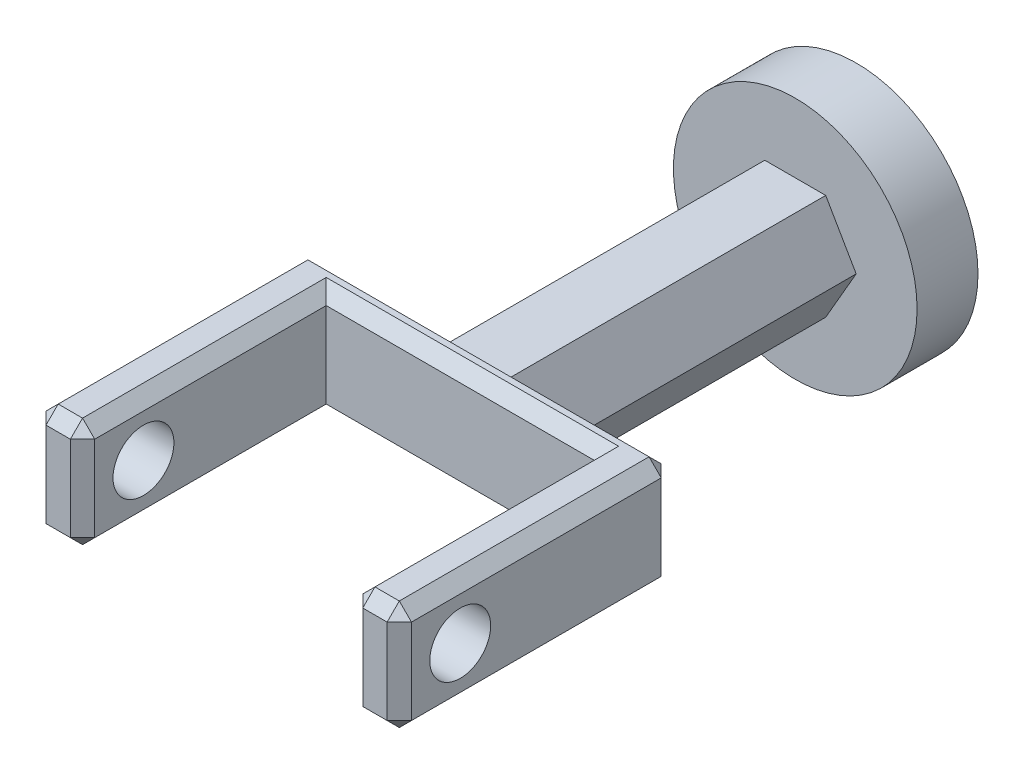
from build123d import *

# Parameters (mm, degrees)
CROQUIS1_R              = 200
SALIENTE_EXTRUIR1_DEPTH = 100
SALIENTE_EXTRUIR2_DEPTH = 500
CROQUIS3_W              = 600
CROQUIS3_H              = 180
SALIENTE_EXTRUIR3_DEPTH = 50
CROQUIS4_W              = 80
CROQUIS4_H              = 180
SALIENTE_EXTRUIR4_DEPTH = 400
CROQUIS5_R              = 50
CORTAR_EXTRUIR1_DEPTH   = 1226.765067213


with BuildPart() as part:
    # Croquis1 → Saliente-Extruir1 (new body)
    with BuildSketch(Plane.XY):
        Circle(CROQUIS1_R)
    extrude(amount=SALIENTE_EXTRUIR1_DEPTH)

    # Croquis2 → Saliente-Extruir2 (add)
    with BuildSketch(Plane.XY.offset(100)):
        Polygon((100, 0), (50, 86.602540378), (-50, 86.602540378), (-100, 0), (-50, -86.602540378), (50, -86.602540378), align=None)
    extrude(amount=SALIENTE_EXTRUIR2_DEPTH)

    # Croquis3 → Saliente-Extruir3 (add)
    with BuildSketch(Plane.XY.offset(600)):
        Rectangle(CROQUIS3_W, CROQUIS3_H)
    extrude(amount=SALIENTE_EXTRUIR3_DEPTH)

    # Croquis4 → Saliente-Extruir4 (add)
    with BuildSketch(Plane.XY.offset(650)):
        with Locations((-260, 0)):
            Rectangle(CROQUIS4_W, CROQUIS4_H)
        with Locations((260, 0)):
            Rectangle(CROQUIS4_W, CROQUIS4_H)
    extrude(amount=SALIENTE_EXTRUIR4_DEPTH)

    # Chaflán1
    # the kernel refuses this chamfer: 20 mm, written as the material it takes off along each edge
    with BuildSketch(Plane(origin=(-233.333333333, 76.666666667, 1036.666666667), x_dir=(0.7071067811865475, -0.7071067811865475, 0), z_dir=(0.5773502691896257, 0.5773502691896257, 0.5773502691896257)), Plane(origin=(-286.666666667, 76.666666667, 1036.666666667), x_dir=(0, -0.7071067811865475, 0.7071067811865475), z_dir=(-0.577350269189627, 0.5773502691896253, 0.5773502691896253)), Plane(origin=(-286.666666667, -76.666666667, 613.333333333), x_dir=(-0.7071067811865475, 0, 0.7071067811865475), z_dir=(-0.5773502691896257, -0.5773502691896257, -0.5773502691896257)), Plane(origin=(286.666666667, 76.666666667, 1036.666666667), x_dir=(0.7071067811865466, -0.7071067811865486, 0), z_dir=(0.5773502691896264, 0.5773502691896247, 0.5773502691896264)), Plane(origin=(286.666666667, 76.666666667, 613.333333333), x_dir=(-2.009718347115232e-15, -0.7071067811865475, -0.7071067811865475), z_dir=(0.5773502691896264, 0.5773502691896247, -0.5773502691896264)), Plane(origin=(286.666666667, -76.666666667, 613.333333333), x_dir=(0, -0.7071067811865475, 0.7071067811865475), z_dir=(0.5773502691896257, -0.5773502691896257, -0.5773502691896257)), Plane(origin=(233.333333333, 76.666666667, 1036.666666667), x_dir=(1.004859173557616e-15, -0.7071067811865475, 0.7071067811865475), z_dir=(-0.5773502691896263, 0.5773502691896251, 0.5773502691896258))) as chafl_n1_piece_1:
        Polygon((-14.142135624, 8.164965809), (14.142135624, 8.164965809), (0, -16.329931619), align=None)
    extrude(amount=25.403411844, mode=Mode.SUBTRACT)
    with BuildSketch(Plane(origin=(233.333333333, -76.666666667, 1036.666666667), x_dir=(0, 0.7071067811865472, 0.7071067811865478), z_dir=(-0.5773502691896256, -0.5773502691896261, 0.5773502691896256)), Plane(origin=(-233.333333333, -76.666666667, 1036.666666667), x_dir=(-0.7071067811865475, 0, 0.7071067811865475), z_dir=(0.5773502691896255, -0.5773502691896263, 0.5773502691896255)), Plane(origin=(-286.666666667, 76.666666667, 613.333333333), x_dir=(0, -0.7071067811865475, -0.7071067811865475), z_dir=(-0.5773502691896257, 0.5773502691896257, -0.5773502691896257)), Plane(origin=(-286.666666667, -76.666666667, 1036.666666667), x_dir=(-0.7071067811865475, 0, -0.7071067811865475), z_dir=(-0.5773502691896257, -0.5773502691896257, 0.5773502691896257)), Plane(origin=(286.666666667, -76.666666667, 1036.666666667), x_dir=(0.7071067811865475, 0.7071067811865475, 0), z_dir=(0.5773502691896257, -0.5773502691896257, 0.5773502691896257))) as chafl_n1_piece_2:
        Polygon((-14.142135624, -8.164965809), (14.142135624, -8.164965809), (0, 16.329931619), align=None)
    extrude(amount=25.403411844, mode=Mode.SUBTRACT)
    with BuildSketch(Plane(origin=(-220, 90, 650), x_dir=(-0.9996219169112968, 0.027495876610586317, 0), z_dir=(0, 0, 1)), Plane(origin=(220, -90, 650), x_dir=(0.9996219169112968, -0.027495876610585626, 0), z_dir=(0, 0, 1))) as chafl_n1_piece_3:
        with BuildLine():
            Line((20.573463904, 0), (-1.130943098, 20.54235587))
            Line((-1.130943098, 20.54235587), (-1.530791864, 20.53135752))
            ThreePointArc((-1.530791864, 20.53135752), (-0.682584541, 10.267956593), (-0.399848767, -0.010998351))
            Line((-0.399848767, -0.010998351), (0.010998351, -0.399848767))
            ThreePointArc((0.010998351, -0.399848767), (10.289953294, -0.117112992), (20.584462254, -0.399848767))
            Line((20.584462254, -0.399848767), (20.573463904, 0))
        make_face()
    extrude(amount=451.433659759, mode=Mode.SUBTRACT)
    with BuildSketch(Plane(origin=(-220, -90, 650), x_dir=(-0.9996219169112968, -0.027495876610586282, 0), z_dir=(0, 0, 1)), Plane(origin=(220, 90, 650), x_dir=(0.9996219169112968, 0.027495876610586355, 0), z_dir=(0, 0, 1))) as chafl_n1_piece_4:
        with BuildLine():
            Line((20.573463904, 0), (-1.130943098, -20.54235587))
            Line((-1.130943098, -20.54235587), (-1.530791864, -20.53135752))
            ThreePointArc((-1.530791864, -20.53135752), (-0.682584541, -10.267956593), (-0.399848767, 0.010998351))
            Line((-0.399848767, 0.010998351), (0.010998351, 0.399848767))
            ThreePointArc((0.010998351, 0.399848767), (10.289953294, 0.117112992), (20.584462254, 0.399848767))
            Line((20.584462254, 0.399848767), (20.573463904, 0))
        make_face()
    extrude(amount=451.433659759, mode=Mode.SUBTRACT)
    with BuildSketch(Plane(origin=(-300, 90, 548.566340241), x_dir=(0.9996219169112968, 0.027495876610586282, 0), z_dir=(0, 0, 1)), Plane(origin=(300, 90, 1101.433659759), x_dir=(-0.9996219169112968, 0.027495876610586282, 0), z_dir=(0, 0, -1))) as chafl_n1_piece_5:
        with BuildLine():
            Line((20.573463904, 0), (-1.130943098, -20.54235587))
            Line((-1.130943098, -20.54235587), (-1.530791864, -20.53135752))
            ThreePointArc((-1.530791864, -20.53135752), (-0.682584541, -10.267956593), (-0.399848767, 0.010998351))
            Line((-0.399848767, 0.010998351), (0.010998351, 0.399848767))
            ThreePointArc((0.010998351, 0.399848767), (10.289953294, 0.117112992), (20.584462254, 0.399848767))
            Line((20.584462254, 0.399848767), (20.573463904, 0))
        make_face()
    extrude(amount=552.867319519, mode=Mode.SUBTRACT)
    with BuildSketch(Plane(origin=(-300, -90, 548.566340241), x_dir=(0.9996219169112968, -0.027495876610586282, 0), z_dir=(0, 0, 1)), Plane(origin=(300, -90, 1101.433659759), x_dir=(-0.9996219169112968, -0.027495876610586282, 0), z_dir=(0, 0, -1))) as chafl_n1_piece_6:
        with BuildLine():
            Line((20.573463904, 0), (-1.130943098, 20.54235587))
            Line((-1.130943098, 20.54235587), (-1.530791864, 20.53135752))
            ThreePointArc((-1.530791864, 20.53135752), (-0.682584541, 10.267956593), (-0.399848767, -0.010998351))
            Line((-0.399848767, -0.010998351), (0.010998351, -0.399848767))
            ThreePointArc((0.010998351, -0.399848767), (10.289953294, -0.117112992), (20.584462254, -0.399848767))
            Line((20.584462254, -0.399848767), (20.573463904, 0))
        make_face()
    extrude(amount=552.867319519, mode=Mode.SUBTRACT)
    with BuildSketch(Plane(origin=(-351.433659759, -90, 1050), x_dir=(0, -0.02749587661058643, -0.9996219169112968), z_dir=(1, 0, 0)), Plane(origin=(-168.566340241, 90, 1050), x_dir=(0, 0.02749587661058643, -0.9996219169112968), z_dir=(-1, 0, 0))) as chafl_n1_piece_7:
        with BuildLine():
            Line((20.573463904, 0), (-1.130943098, 20.54235587))
            Line((-1.130943098, 20.54235587), (-1.530791864, 20.53135752))
            ThreePointArc((-1.530791864, 20.53135752), (-0.682584541, 10.267956593), (-0.399848767, -0.010998351))
            Line((-0.399848767, -0.010998351), (0.010998351, -0.399848767))
            ThreePointArc((0.010998351, -0.399848767), (10.289953294, -0.117112992), (20.584462254, -0.399848767))
            Line((20.584462254, -0.399848767), (20.573463904, 0))
        make_face()
    extrude(amount=182.867319519, mode=Mode.SUBTRACT)
    with BuildSketch(Plane(origin=(-220, -141.433659759, 1050), x_dir=(0.02749587661058643, 0, -0.9996219169112968), z_dir=(0, 1, 0)), Plane(origin=(220, -141.433659759, 1050), x_dir=(0.9996219169112969, 0, 0.027495876610582178), z_dir=(0, 1, 0))) as chafl_n1_piece_8:
        with BuildLine():
            Line((20.573463904, 0), (-1.130943098, 20.54235587))
            Line((-1.130943098, 20.54235587), (-1.530791864, 20.53135752))
            ThreePointArc((-1.530791864, 20.53135752), (-0.682584541, 10.267956593), (-0.399848767, -0.010998351))
            Line((-0.399848767, -0.010998351), (0.010998351, -0.399848767))
            ThreePointArc((0.010998351, -0.399848767), (10.289953294, -0.117112992), (20.584462254, -0.399848767))
            Line((20.584462254, -0.399848767), (20.573463904, 0))
        make_face()
    extrude(amount=282.867319519, mode=Mode.SUBTRACT)
    with BuildSketch(Plane(origin=(-300, 141.433659759, 1050), x_dir=(0.9996219169112969, 0, 0.02749587661058214), z_dir=(0, -1, 0)), Plane(origin=(300, 141.433659759, 1050), x_dir=(0.027495876610587815, 0, -0.9996219169112968), z_dir=(0, -1, 0)), Plane(origin=(-300, -141.433659759, 600), x_dir=(0.9996219169112968, 0, -0.027495876610587663), z_dir=(0, 1, 0)), Plane(origin=(300, 141.433659759, 600), x_dir=(-0.9996219169112968, 0, -0.027495876610587663), z_dir=(0, -1, 0))) as chafl_n1_piece_9:
        with BuildLine():
            Line((20.573463904, 0), (-1.130943098, -20.54235587))
            Line((-1.130943098, -20.54235587), (-1.530791864, -20.53135752))
            ThreePointArc((-1.530791864, -20.53135752), (-0.682584541, -10.267956593), (-0.399848767, 0.010998351))
            Line((-0.399848767, 0.010998351), (0.010998351, 0.399848767))
            ThreePointArc((0.010998351, 0.399848767), (10.289953294, 0.117112992), (20.584462254, 0.399848767))
            Line((20.584462254, 0.399848767), (20.573463904, 0))
        make_face()
    extrude(amount=282.867319519, mode=Mode.SUBTRACT)
    with BuildSketch(Plane(origin=(168.566340241, 90, 1050), x_dir=(0, 0.02749587661058643, -0.9996219169112968), z_dir=(1, 0, 0)), Plane(origin=(351.433659759, -90, 1050), x_dir=(0, -0.02749587661058643, -0.9996219169112968), z_dir=(-1, 0, 0))) as chafl_n1_piece_10:
        with BuildLine():
            Line((20.573463904, 0), (-1.130943098, -20.54235587))
            Line((-1.130943098, -20.54235587), (-1.530791864, -20.53135752))
            ThreePointArc((-1.530791864, -20.53135752), (-0.682584541, -10.267956593), (-0.399848767, 0.010998351))
            Line((-0.399848767, 0.010998351), (0.010998351, 0.399848767))
            ThreePointArc((0.010998351, 0.399848767), (10.289953294, 0.117112992), (20.584462254, 0.399848767))
            Line((20.584462254, 0.399848767), (20.573463904, 0))
        make_face()
    extrude(amount=182.867319519, mode=Mode.SUBTRACT)
    with BuildSketch(Plane(origin=(-351.433659759, 90, 600), x_dir=(0, 0.027495876610586282, 0.9996219169112968), z_dir=(1, 0, 0))) as chafl_n1_piece_11_section:
        with BuildLine():
            Line((20.573463904, 0), (-1.130943098, 20.54235587))
            Line((-1.130943098, 20.54235587), (-1.530791864, 20.53135752))
            ThreePointArc((-1.530791864, 20.53135752), (-0.682584541, 10.267956593), (-0.399848767, -0.010998351))
            Line((-0.399848767, -0.010998351), (0.010998351, -0.399848767))
            ThreePointArc((0.010998351, -0.399848767), (10.289953294, -0.117112992), (20.584462254, -0.399848767))
            Line((20.584462254, -0.399848767), (20.573463904, 0))
        make_face()
    chafl_n1_piece_11 = extrude(amount=702.867319519, mode=Mode.PRIVATE)
    chafl_n1_piece_11 = split(chafl_n1_piece_11, bisect_by=Plane(origin=(-86.659672544, 23.106124943, 609.411385689), z_dir=(-0.8660254037844387, 0.5, 0)), keep=Keep.TOP, mode=Mode.PRIVATE)
    chafl_n1_piece_11 = split(chafl_n1_piece_11, bisect_by=Plane(origin=(-200.134238493, 86.602540378, 609.411385689), z_dir=(0, 1, 0)), keep=Keep.TOP, mode=Mode.PRIVATE)
    add(chafl_n1_piece_11, mode=Mode.SUBTRACT)
    with BuildSketch(Plane(origin=(-351.433659759, 90, 600), x_dir=(0, 0.027495876610586282, 0.9996219169112968), z_dir=(1, 0, 0))) as chafl_n1_piece_12_section:
        with BuildLine():
            Line((20.573463904, 0), (-1.130943098, 20.54235587))
            Line((-1.130943098, 20.54235587), (-1.530791864, 20.53135752))
            ThreePointArc((-1.530791864, 20.53135752), (-0.682584541, 10.267956593), (-0.399848767, -0.010998351))
            Line((-0.399848767, -0.010998351), (0.010998351, -0.399848767))
            ThreePointArc((0.010998351, -0.399848767), (10.289953294, -0.117112992), (20.584462254, -0.399848767))
            Line((20.584462254, -0.399848767), (20.573463904, 0))
        make_face()
    chafl_n1_piece_12 = extrude(amount=702.867319519, mode=Mode.PRIVATE)
    chafl_n1_piece_12 = split(chafl_n1_piece_12, bisect_by=Plane(origin=(-90.598996107, 16.283016385, 605.202318191), z_dir=(-0.8660254037844387, 0.5, 0)), keep=Keep.TOP, mode=Mode.PRIVATE)
    chafl_n1_piece_12 = split(chafl_n1_piece_12, bisect_by=Plane(origin=(-202.385280529, 86.602540378, 605.202318191), z_dir=(0, -1, 0)), keep=Keep.TOP, mode=Mode.PRIVATE)
    add(chafl_n1_piece_12, mode=Mode.SUBTRACT)
    with BuildSketch(Plane(origin=(-351.433659759, 90, 600), x_dir=(0, 0.027495876610586282, 0.9996219169112968), z_dir=(1, 0, 0))) as chafl_n1_piece_13_section:
        with BuildLine():
            Line((20.573463904, 0), (-1.130943098, 20.54235587))
            Line((-1.130943098, 20.54235587), (-1.530791864, 20.53135752))
            ThreePointArc((-1.530791864, 20.53135752), (-0.682584541, 10.267956593), (-0.399848767, -0.010998351))
            Line((-0.399848767, -0.010998351), (0.010998351, -0.399848767))
            ThreePointArc((0.010998351, -0.399848767), (10.289953294, -0.117112992), (20.584462254, -0.399848767))
            Line((20.584462254, -0.399848767), (20.573463904, 0))
        make_face()
    chafl_n1_piece_13 = extrude(amount=702.867319519, mode=Mode.PRIVATE)
    chafl_n1_piece_13 = split(chafl_n1_piece_13, bisect_by=Plane(origin=(-36.633682246, 109.753681839, 609.395218204), z_dir=(0.8660254037844387, -0.5, 0)), keep=Keep.TOP, mode=Mode.PRIVATE)
    chafl_n1_piece_13 = split(chafl_n1_piece_13, bisect_by=Plane(origin=(0, 86.602540378, 609.395218204), z_dir=(0, 1, 0)), keep=Keep.TOP, mode=Mode.PRIVATE)
    chafl_n1_piece_13 = split(chafl_n1_piece_13, bisect_by=Plane(origin=(36.633682246, 109.753681839, 609.395218204), z_dir=(-0.8660254037844387, -0.5000000000000001, 0)), keep=Keep.TOP, mode=Mode.PRIVATE)
    add(chafl_n1_piece_13, mode=Mode.SUBTRACT)
    with BuildSketch(Plane(origin=(-351.433659759, 90, 600), x_dir=(0, 0.027495876610586282, 0.9996219169112968), z_dir=(1, 0, 0))) as chafl_n1_piece_14_section:
        with BuildLine():
            Line((20.573463904, 0), (-1.130943098, 20.54235587))
            Line((-1.130943098, 20.54235587), (-1.530791864, 20.53135752))
            ThreePointArc((-1.530791864, 20.53135752), (-0.682584541, 10.267956593), (-0.399848767, -0.010998351))
            Line((-0.399848767, -0.010998351), (0.010998351, -0.399848767))
            ThreePointArc((0.010998351, -0.399848767), (10.289953294, -0.117112992), (20.584462254, -0.399848767))
            Line((20.584462254, -0.399848767), (20.573463904, 0))
        make_face()
    chafl_n1_piece_14 = extrude(amount=702.867319519, mode=Mode.PRIVATE)
    chafl_n1_piece_14 = split(chafl_n1_piece_14, bisect_by=Plane(origin=(200.134238493, 86.602540378, 609.411385689), z_dir=(0, 1, 0)), keep=Keep.TOP, mode=Mode.PRIVATE)
    chafl_n1_piece_14 = split(chafl_n1_piece_14, bisect_by=Plane(origin=(86.659672544, 23.106124943, 609.411385689), z_dir=(0.8660254037844387, 0.5000000000000001, 0)), keep=Keep.TOP, mode=Mode.PRIVATE)
    add(chafl_n1_piece_14, mode=Mode.SUBTRACT)
    with BuildSketch(Plane(origin=(-351.433659759, 90, 600), x_dir=(0, 0.027495876610586282, 0.9996219169112968), z_dir=(1, 0, 0))) as chafl_n1_piece_15_section:
        with BuildLine():
            Line((20.573463904, 0), (-1.130943098, 20.54235587))
            Line((-1.130943098, 20.54235587), (-1.530791864, 20.53135752))
            ThreePointArc((-1.530791864, 20.53135752), (-0.682584541, 10.267956593), (-0.399848767, -0.010998351))
            Line((-0.399848767, -0.010998351), (0.010998351, -0.399848767))
            ThreePointArc((0.010998351, -0.399848767), (10.289953294, -0.117112992), (20.584462254, -0.399848767))
            Line((20.584462254, -0.399848767), (20.573463904, 0))
        make_face()
    chafl_n1_piece_15 = extrude(amount=702.867319519, mode=Mode.PRIVATE)
    chafl_n1_piece_15 = split(chafl_n1_piece_15, bisect_by=Plane(origin=(202.385280529, 86.602540378, 605.202318191), z_dir=(0, -1, 0)), keep=Keep.TOP, mode=Mode.PRIVATE)
    chafl_n1_piece_15 = split(chafl_n1_piece_15, bisect_by=Plane(origin=(90.598996107, 16.283016385, 605.202318191), z_dir=(0.8660254037844387, 0.5000000000000001, 0)), keep=Keep.TOP, mode=Mode.PRIVATE)
    add(chafl_n1_piece_15, mode=Mode.SUBTRACT)
    with BuildSketch(Plane(origin=(351.433659759, -90, 600), x_dir=(0, 0.9996219169112968, -0.0274958766105877), z_dir=(-1, 0, 0))) as chafl_n1_piece_16_section:
        with BuildLine():
            Line((20.573463904, 0), (-1.130943098, -20.54235587))
            Line((-1.130943098, -20.54235587), (-1.530791864, -20.53135752))
            ThreePointArc((-1.530791864, -20.53135752), (-0.682584541, -10.267956593), (-0.399848767, 0.010998351))
            Line((-0.399848767, 0.010998351), (0.010998351, 0.399848767))
            ThreePointArc((0.010998351, 0.399848767), (10.289953294, 0.117112992), (20.584462254, 0.399848767))
            Line((20.584462254, 0.399848767), (20.573463904, 0))
        make_face()
    chafl_n1_piece_16 = extrude(amount=702.867319519, mode=Mode.PRIVATE)
    chafl_n1_piece_16 = split(chafl_n1_piece_16, bisect_by=Plane(origin=(90.598996107, -16.283016385, 605.202318191), z_dir=(0.8660254037844389, -0.49999999999999956, 0)), keep=Keep.TOP, mode=Mode.PRIVATE)
    chafl_n1_piece_16 = split(chafl_n1_piece_16, bisect_by=Plane(origin=(202.385280529, -86.602540378, 605.202318191), z_dir=(0, 1, 0)), keep=Keep.TOP, mode=Mode.PRIVATE)
    add(chafl_n1_piece_16, mode=Mode.SUBTRACT)
    with BuildSketch(Plane(origin=(351.433659759, -90, 600), x_dir=(0, 0.9996219169112968, -0.0274958766105877), z_dir=(-1, 0, 0))) as chafl_n1_piece_17_section:
        with BuildLine():
            Line((20.573463904, 0), (-1.130943098, -20.54235587))
            Line((-1.130943098, -20.54235587), (-1.530791864, -20.53135752))
            ThreePointArc((-1.530791864, -20.53135752), (-0.682584541, -10.267956593), (-0.399848767, 0.010998351))
            Line((-0.399848767, 0.010998351), (0.010998351, 0.399848767))
            ThreePointArc((0.010998351, 0.399848767), (10.289953294, 0.117112992), (20.584462254, 0.399848767))
            Line((20.584462254, 0.399848767), (20.573463904, 0))
        make_face()
    chafl_n1_piece_17 = extrude(amount=702.867319519, mode=Mode.PRIVATE)
    chafl_n1_piece_17 = split(chafl_n1_piece_17, bisect_by=Plane(origin=(86.659672544, -23.106124943, 609.411385689), z_dir=(0.8660254037844389, -0.49999999999999956, 0)), keep=Keep.TOP, mode=Mode.PRIVATE)
    chafl_n1_piece_17 = split(chafl_n1_piece_17, bisect_by=Plane(origin=(200.134238493, -86.602540378, 609.411385689), z_dir=(0, -1, 0)), keep=Keep.TOP, mode=Mode.PRIVATE)
    add(chafl_n1_piece_17, mode=Mode.SUBTRACT)
    with BuildSketch(Plane(origin=(351.433659759, -90, 600), x_dir=(0, 0.9996219169112968, -0.0274958766105877), z_dir=(-1, 0, 0))) as chafl_n1_piece_18_section:
        with BuildLine():
            Line((20.573463904, 0), (-1.130943098, -20.54235587))
            Line((-1.130943098, -20.54235587), (-1.530791864, -20.53135752))
            ThreePointArc((-1.530791864, -20.53135752), (-0.682584541, -10.267956593), (-0.399848767, 0.010998351))
            Line((-0.399848767, 0.010998351), (0.010998351, 0.399848767))
            ThreePointArc((0.010998351, 0.399848767), (10.289953294, 0.117112992), (20.584462254, 0.399848767))
            Line((20.584462254, 0.399848767), (20.573463904, 0))
        make_face()
    chafl_n1_piece_18 = extrude(amount=702.867319519, mode=Mode.PRIVATE)
    chafl_n1_piece_18 = split(chafl_n1_piece_18, bisect_by=Plane(origin=(36.633682246, -109.753681839, 609.395218204), z_dir=(-0.8660254037844389, 0.49999999999999956, 0)), keep=Keep.TOP, mode=Mode.PRIVATE)
    chafl_n1_piece_18 = split(chafl_n1_piece_18, bisect_by=Plane(origin=(0, -86.602540378, 609.395218204), z_dir=(0, -1, 0)), keep=Keep.TOP, mode=Mode.PRIVATE)
    chafl_n1_piece_18 = split(chafl_n1_piece_18, bisect_by=Plane(origin=(-36.633682246, -109.753681839, 609.395218204), z_dir=(0.8660254037844387, 0.5000000000000001, 0)), keep=Keep.TOP, mode=Mode.PRIVATE)
    add(chafl_n1_piece_18, mode=Mode.SUBTRACT)
    with BuildSketch(Plane(origin=(351.433659759, -90, 600), x_dir=(0, 0.9996219169112968, -0.0274958766105877), z_dir=(-1, 0, 0))) as chafl_n1_piece_19_section:
        with BuildLine():
            Line((20.573463904, 0), (-1.130943098, -20.54235587))
            Line((-1.130943098, -20.54235587), (-1.530791864, -20.53135752))
            ThreePointArc((-1.530791864, -20.53135752), (-0.682584541, -10.267956593), (-0.399848767, 0.010998351))
            Line((-0.399848767, 0.010998351), (0.010998351, 0.399848767))
            ThreePointArc((0.010998351, 0.399848767), (10.289953294, 0.117112992), (20.584462254, 0.399848767))
            Line((20.584462254, 0.399848767), (20.573463904, 0))
        make_face()
    chafl_n1_piece_19 = extrude(amount=702.867319519, mode=Mode.PRIVATE)
    chafl_n1_piece_19 = split(chafl_n1_piece_19, bisect_by=Plane(origin=(-202.385280529, -86.602540378, 605.202318191), z_dir=(0, 1, 0)), keep=Keep.TOP, mode=Mode.PRIVATE)
    chafl_n1_piece_19 = split(chafl_n1_piece_19, bisect_by=Plane(origin=(-90.598996107, -16.283016385, 605.202318191), z_dir=(-0.8660254037844387, -0.5000000000000001, 0)), keep=Keep.TOP, mode=Mode.PRIVATE)
    add(chafl_n1_piece_19, mode=Mode.SUBTRACT)
    with BuildSketch(Plane(origin=(351.433659759, -90, 600), x_dir=(0, 0.9996219169112968, -0.0274958766105877), z_dir=(-1, 0, 0))) as chafl_n1_piece_20_section:
        with BuildLine():
            Line((20.573463904, 0), (-1.130943098, -20.54235587))
            Line((-1.130943098, -20.54235587), (-1.530791864, -20.53135752))
            ThreePointArc((-1.530791864, -20.53135752), (-0.682584541, -10.267956593), (-0.399848767, 0.010998351))
            Line((-0.399848767, 0.010998351), (0.010998351, 0.399848767))
            ThreePointArc((0.010998351, 0.399848767), (10.289953294, 0.117112992), (20.584462254, 0.399848767))
            Line((20.584462254, 0.399848767), (20.573463904, 0))
        make_face()
    chafl_n1_piece_20 = extrude(amount=702.867319519, mode=Mode.PRIVATE)
    chafl_n1_piece_20 = split(chafl_n1_piece_20, bisect_by=Plane(origin=(-200.134238493, -86.602540378, 609.411385689), z_dir=(0, -1, 0)), keep=Keep.TOP, mode=Mode.PRIVATE)
    chafl_n1_piece_20 = split(chafl_n1_piece_20, bisect_by=Plane(origin=(-86.659672544, -23.106124943, 609.411385689), z_dir=(-0.8660254037844387, -0.5000000000000001, 0)), keep=Keep.TOP, mode=Mode.PRIVATE)
    add(chafl_n1_piece_20, mode=Mode.SUBTRACT)
    with BuildSketch(Plane(origin=(-220, 90, 650), x_dir=(0, 0.027495876610586282, -0.9996219169112968), z_dir=(1, 0, 0)), Plane(origin=(220, -90, 650), x_dir=(0, -0.027495876610586282, -0.9996219169112968), z_dir=(-1, 0, 0))) as chafl_n1_piece_21:
        with BuildLine():
            Line((20.573463904, 0), (-1.130943098, -20.54235587))
            Line((-1.130943098, -20.54235587), (-1.530791864, -20.53135752))
            ThreePointArc((-1.530791864, -20.53135752), (-0.682584541, -10.267956593), (-0.399848767, 0.010998351))
            Line((-0.399848767, 0.010998351), (0.010998351, 0.399848767))
            ThreePointArc((0.010998351, 0.399848767), (10.289953294, 0.117112992), (20.584462254, 0.399848767))
            Line((20.584462254, 0.399848767), (20.573463904, 0))
        make_face()
    extrude(amount=440, mode=Mode.SUBTRACT)
    with BuildSketch(Plane(origin=(-220, 90, 598.566340241), x_dir=(-0.9996219169112968, 0.027495876610586317, 0), z_dir=(0, 0, 1))) as chafl_n1_piece_22a_section:
        with BuildLine():
            Line((20.573463904, 0), (-1.130943098, 20.54235587))
            Line((-1.130943098, 20.54235587), (-1.530791864, 20.53135752))
            ThreePointArc((-1.530791864, 20.53135752), (-0.682584541, 10.267956593), (-0.399848767, -0.010998351))
            Line((-0.399848767, -0.010998351), (0.010998351, -0.399848767))
            ThreePointArc((0.010998351, -0.399848767), (10.289953294, -0.117112992), (20.584462254, -0.399848767))
            Line((20.584462254, -0.399848767), (20.573463904, 0))
        make_face()
    chafl_n1_piece_22a = extrude(amount=502.867319519, mode=Mode.PRIVATE)
    chafl_n1_piece_22a = split(chafl_n1_piece_22a, bisect_by=Plane(origin=(-226.595872536, 83.404127464, 650), z_dir=(0, 0, -1)), keep=Keep.TOP, mode=Mode.PRIVATE)
    with BuildSketch(Plane(origin=(-271.433659759, 90, 650), x_dir=(0, 0.027495876610586282, -0.9996219169112968), z_dir=(1, 0, 0))) as chafl_n1_piece_22b_section:
        with BuildLine():
            Line((20.573463904, 0), (-1.130943098, -20.54235587))
            Line((-1.130943098, -20.54235587), (-1.530791864, -20.53135752))
            ThreePointArc((-1.530791864, -20.53135752), (-0.682584541, -10.267956593), (-0.399848767, 0.010998351))
            Line((-0.399848767, 0.010998351), (0.010998351, 0.399848767))
            ThreePointArc((0.010998351, 0.399848767), (10.289953294, 0.117112992), (20.584462254, 0.399848767))
            Line((20.584462254, 0.399848767), (20.573463904, 0))
        make_face()
    chafl_n1_piece_22b = extrude(amount=491.433659759, mode=Mode.PRIVATE)
    chafl_n1_piece_22b = split(chafl_n1_piece_22b, bisect_by=Plane(origin=(-220, 83.404127464, 643.404127464), z_dir=(-1, 0, 0)), keep=Keep.TOP, mode=Mode.PRIVATE)
    chafl_n1_piece_22 = chafl_n1_piece_22a & chafl_n1_piece_22b
    add(chafl_n1_piece_22, mode=Mode.SUBTRACT)
    with BuildSketch(Plane(origin=(220, -90, 598.566340241), x_dir=(0.9996219169112968, -0.027495876610586317, 0), z_dir=(0, 0, 1))) as chafl_n1_piece_23a_section:
        with BuildLine():
            Line((20.573463904, 0), (-1.130943098, 20.54235587))
            Line((-1.130943098, 20.54235587), (-1.530791864, 20.53135752))
            ThreePointArc((-1.530791864, 20.53135752), (-0.682584541, 10.267956593), (-0.399848767, -0.010998351))
            Line((-0.399848767, -0.010998351), (0.010998351, -0.399848767))
            ThreePointArc((0.010998351, -0.399848767), (10.289953294, -0.117112992), (20.584462254, -0.399848767))
            Line((20.584462254, -0.399848767), (20.573463904, 0))
        make_face()
    chafl_n1_piece_23a = extrude(amount=502.867319519, mode=Mode.PRIVATE)
    chafl_n1_piece_23a = split(chafl_n1_piece_23a, bisect_by=Plane(origin=(226.595872536, -83.404127464, 650), z_dir=(0, 0, -1)), keep=Keep.TOP, mode=Mode.PRIVATE)
    with BuildSketch(Plane(origin=(271.433659759, -90, 650), x_dir=(0, -0.027495876610586282, -0.9996219169112968), z_dir=(-1, 0, 0))) as chafl_n1_piece_23b_section:
        with BuildLine():
            Line((20.573463904, 0), (-1.130943098, -20.54235587))
            Line((-1.130943098, -20.54235587), (-1.530791864, -20.53135752))
            ThreePointArc((-1.530791864, -20.53135752), (-0.682584541, -10.267956593), (-0.399848767, 0.010998351))
            Line((-0.399848767, 0.010998351), (0.010998351, 0.399848767))
            ThreePointArc((0.010998351, 0.399848767), (10.289953294, 0.117112992), (20.584462254, 0.399848767))
            Line((20.584462254, 0.399848767), (20.573463904, 0))
        make_face()
    chafl_n1_piece_23b = extrude(amount=491.433659759, mode=Mode.PRIVATE)
    chafl_n1_piece_23b = split(chafl_n1_piece_23b, bisect_by=Plane(origin=(220, -83.404127464, 643.404127464), z_dir=(1, 0, 0)), keep=Keep.TOP, mode=Mode.PRIVATE)
    chafl_n1_piece_23 = chafl_n1_piece_23a & chafl_n1_piece_23b
    add(chafl_n1_piece_23, mode=Mode.SUBTRACT)
    with BuildSketch(Plane(origin=(220, -90, 650), x_dir=(0, -0.027495876610586282, -0.9996219169112968), z_dir=(-1, 0, 0))) as chafl_n1_piece_24a_section:
        with BuildLine():
            Line((20.573463904, 0), (-1.130943098, -20.54235587))
            Line((-1.130943098, -20.54235587), (-1.530791864, -20.53135752))
            ThreePointArc((-1.530791864, -20.53135752), (-0.682584541, -10.267956593), (-0.399848767, 0.010998351))
            Line((-0.399848767, 0.010998351), (0.010998351, 0.399848767))
            ThreePointArc((0.010998351, 0.399848767), (10.289953294, 0.117112992), (20.584462254, 0.399848767))
            Line((20.584462254, 0.399848767), (20.573463904, 0))
        make_face()
    chafl_n1_piece_24a = extrude(amount=491.433659759, mode=Mode.PRIVATE)
    chafl_n1_piece_24a = split(chafl_n1_piece_24a, bisect_by=Plane(origin=(-220, -83.404127464, 643.404127464), z_dir=(-1, 0, 0)), keep=Keep.TOP, mode=Mode.PRIVATE)
    with BuildSketch(Plane(origin=(-220, -90, 598.566340241), x_dir=(-0.9996219169112968, -0.027495876610586317, 0), z_dir=(0, 0, 1))) as chafl_n1_piece_24b_section:
        with BuildLine():
            Line((20.573463904, 0), (-1.130943098, -20.54235587))
            Line((-1.130943098, -20.54235587), (-1.530791864, -20.53135752))
            ThreePointArc((-1.530791864, -20.53135752), (-0.682584541, -10.267956593), (-0.399848767, 0.010998351))
            Line((-0.399848767, 0.010998351), (0.010998351, 0.399848767))
            ThreePointArc((0.010998351, 0.399848767), (10.289953294, 0.117112992), (20.584462254, 0.399848767))
            Line((20.584462254, 0.399848767), (20.573463904, 0))
        make_face()
    chafl_n1_piece_24b = extrude(amount=502.867319519, mode=Mode.PRIVATE)
    chafl_n1_piece_24b = split(chafl_n1_piece_24b, bisect_by=Plane(origin=(-226.595872536, -83.404127464, 650), z_dir=(0, 0, -1)), keep=Keep.TOP, mode=Mode.PRIVATE)
    chafl_n1_piece_24 = chafl_n1_piece_24a & chafl_n1_piece_24b
    add(chafl_n1_piece_24, mode=Mode.SUBTRACT)
    with BuildSketch(Plane(origin=(-220, 90, 650), x_dir=(0, 0.027495876610586282, -0.9996219169112968), z_dir=(1, 0, 0))) as chafl_n1_piece_25a_section:
        with BuildLine():
            Line((20.573463904, 0), (-1.130943098, -20.54235587))
            Line((-1.130943098, -20.54235587), (-1.530791864, -20.53135752))
            ThreePointArc((-1.530791864, -20.53135752), (-0.682584541, -10.267956593), (-0.399848767, 0.010998351))
            Line((-0.399848767, 0.010998351), (0.010998351, 0.399848767))
            ThreePointArc((0.010998351, 0.399848767), (10.289953294, 0.117112992), (20.584462254, 0.399848767))
            Line((20.584462254, 0.399848767), (20.573463904, 0))
        make_face()
    chafl_n1_piece_25a = extrude(amount=491.433659759, mode=Mode.PRIVATE)
    chafl_n1_piece_25a = split(chafl_n1_piece_25a, bisect_by=Plane(origin=(220, 83.404127464, 643.404127464), z_dir=(1, 0, 0)), keep=Keep.TOP, mode=Mode.PRIVATE)
    with BuildSketch(Plane(origin=(220, 90, 598.566340241), x_dir=(0.9996219169112968, 0.027495876610586317, 0), z_dir=(0, 0, 1))) as chafl_n1_piece_25b_section:
        with BuildLine():
            Line((20.573463904, 0), (-1.130943098, -20.54235587))
            Line((-1.130943098, -20.54235587), (-1.530791864, -20.53135752))
            ThreePointArc((-1.530791864, -20.53135752), (-0.682584541, -10.267956593), (-0.399848767, 0.010998351))
            Line((-0.399848767, 0.010998351), (0.010998351, 0.399848767))
            ThreePointArc((0.010998351, 0.399848767), (10.289953294, 0.117112992), (20.584462254, 0.399848767))
            Line((20.584462254, 0.399848767), (20.573463904, 0))
        make_face()
    chafl_n1_piece_25b = extrude(amount=502.867319519, mode=Mode.PRIVATE)
    chafl_n1_piece_25b = split(chafl_n1_piece_25b, bisect_by=Plane(origin=(226.595872536, 83.404127464, 650), z_dir=(0, 0, -1)), keep=Keep.TOP, mode=Mode.PRIVATE)
    chafl_n1_piece_25 = chafl_n1_piece_25a & chafl_n1_piece_25b
    add(chafl_n1_piece_25, mode=Mode.SUBTRACT)

    # Croquis5 → Cortar-Extruir1 (cut, through all)
    with BuildSketch(Plane(origin=(300, 0, 0), x_dir=(0, 0, -1), z_dir=(1, 0, 0))):
        with Locations((-950, 0)):
            Circle(CROQUIS5_R)
    extrude(amount=-CORTAR_EXTRUIR1_DEPTH, mode=Mode.SUBTRACT)


solid = part.part
